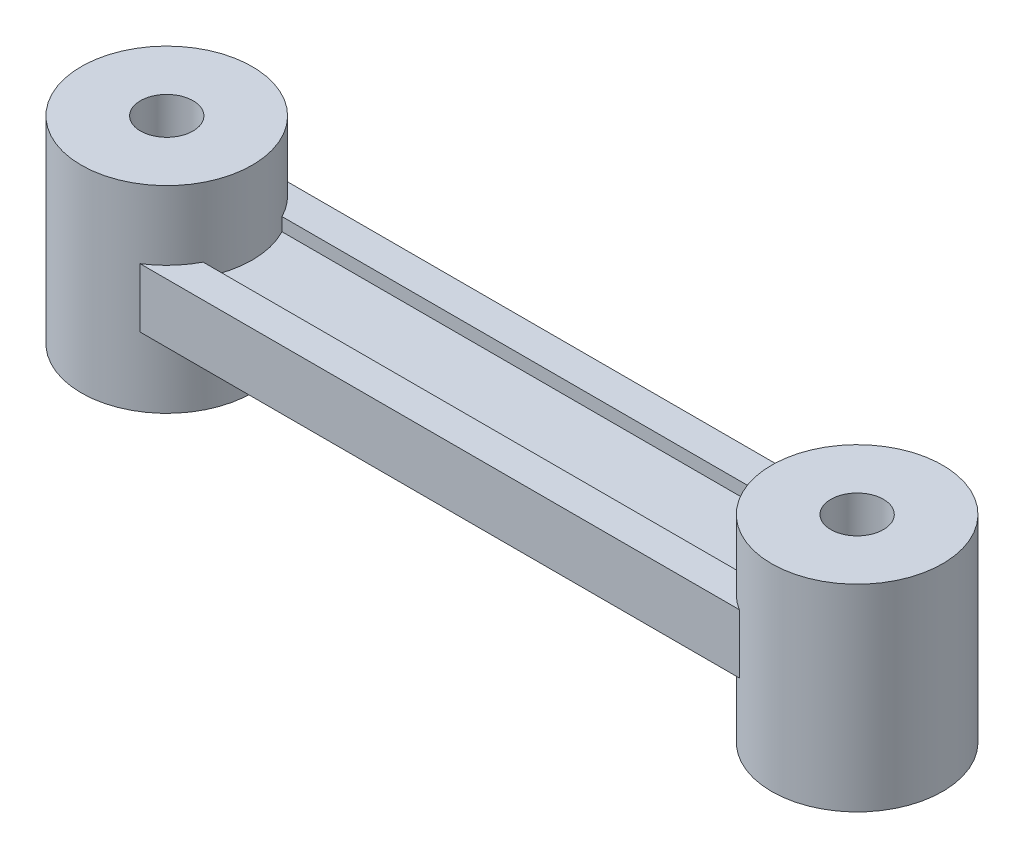
from build123d import *
from build123d.topology import SkipClean

# Parameters (mm, degrees)
SKETCH_1_R          = 13
SKETCH_1_R_2        = 4
EXTRUDE_1_DEPTH     = 15
EXTRUDE_1_2_DEPTH   = 15
EXTRUDE_2_DEPTH     = 4.5
CUT_EXTRUDE_1_DEPTH = 2


with BuildPart() as part:
    # Эскиз1 → Бобышка-Вытянуть1 (new, symmetric)
    with BuildSketch(Plane(origin=(0, 0, 0), x_dir=(1, 0, 0), z_dir=(0, 1, 0))):
        with Locations((-118, 0)):
            Circle(SKETCH_1_R)
        with Locations((-118, 0)):
            Circle(SKETCH_1_R_2, mode=Mode.SUBTRACT)
    extrude(amount=EXTRUDE_1_DEPTH, both=True)



with BuildPart() as body_2:
    # Эскиз1 → Extrude 1 2 (new, symmetric)
    with BuildSketch(Plane(origin=(0, 0, 0), x_dir=(1, 0, 0), z_dir=(0, 1, 0))):
        with Locations((-13, 0)):
            Circle(SKETCH_1_R)
        with Locations((-13, 0)):
            Circle(SKETCH_1_R_2, mode=Mode.SUBTRACT)
    extrude(amount=EXTRUDE_1_2_DEPTH, both=True)


with BuildPart() as part_1:
    add(part.part)

    add(body_2.part)  # Бобышка-Вытянуть2 merges body 2
    # Эскиз2 → Бобышка-Вытянуть2 (add, symmetric)
    with BuildSketch(Plane(origin=(0, 0, 0), x_dir=(1, 0, 0), z_dir=(0, 1, 0))):
        with BuildLine():
            Line((-111.07179677, 11), (-19.92820323, 11))
            ThreePointArc((-19.92820323, 11), (-26, 0), (-19.92820323, -11))
            Line((-19.92820323, -11), (-111.07179677, -11))
            ThreePointArc((-111.07179677, -11), (-105, 0), (-111.07179677, 11))
        make_face()
    extrude(amount=EXTRUDE_2_DEPTH, both=True)

    # Эскиз4 → Вырез-Вытянуть1 (cut)
    with BuildSketch(Plane(origin=(0, 4.5, 0), x_dir=(1, 0, 0), z_dir=(0, 1, 0))):
        with BuildLine():
            Line((-106.467437405, 6), (-24.532562595, 6))
            ThreePointArc((-24.532562595, 6), (-26, 0), (-24.532562595, -6))
            Line((-24.532562595, -6), (-106.467437405, -6))
            ThreePointArc((-106.467437405, -6), (-105, 0), (-106.467437405, 6))
        make_face()
    cut_extrude_1 = extrude(amount=-CUT_EXTRUDE_1_DEPTH, mode=Mode.SUBTRACT)

    # Зеркальное отражение1: Вырез-Вытянуть1 across plane
    with SkipClean():  # the faces are left unmerged after this step: merging them gives an invalid solid
        add(cut_extrude_1.mirror(Plane.ZX), mode=Mode.SUBTRACT)


solid = part_1.part
